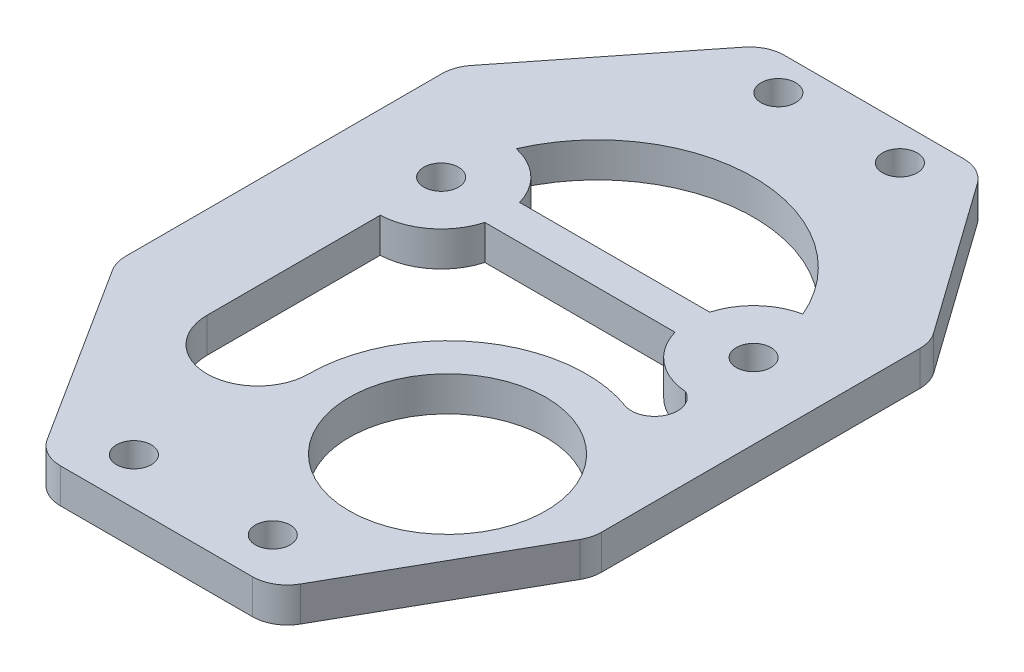
from build123d import *

# Parameters (mm, degrees)
SKETCH1_R          = 8.5
SKETCH1_R_2        = 1.5
BASE_FLANGE1_DEPTH = 3
SCALE1_SCALE       = 1.8


# Sheet-metal steps are written as plain solids
with BuildPart() as part:
    # Sketch1 → Base-Flange1 (new body)
    with BuildSketch(Plane(origin=(0, 0, 0), x_dir=(1, 0, 0), z_dir=(0, 1, 0))):
        with BuildLine():
            Line((19.609421573, -14.059417906), (10.862109445, -29.480175346))
            ThreePointArc((10.862109445, -29.480175346), (9.762567662, -30.59234701), (8.252687872, -31))
            Line((8.252687872, -31), (-8.352599575, -31))
            ThreePointArc((-8.352599575, -31), (-9.796606082, -30.629609326), (-10.884048227, -29.609896806))
            Line((-10.884048227, -29.609896806), (-20.742852548, -14.107625594))
            ThreePointArc((-20.742852548, -14.107625594), (-21.091885276, -13.336076582), (-21.211403896, -12.497728788))
            Line((-21.211403896, -12.497728788), (-21.211403896, 14.839305313))
            ThreePointArc((-21.211403896, 14.839305313), (-21.044943633, 15.824725306), (-20.564035521, 16.700789784))
            Line((-20.564035521, 16.700789784), (-10.150833328, 29.861484472))
            ThreePointArc((-10.150833328, 29.861484472), (-9.105019706, 30.700412322), (-7.798201703, 31))
            Line((-7.798201703, 31), (7.702138241, 31))
            ThreePointArc((7.702138241, 31), (9.077698333, 30.666052219), (10.147014932, 29.738556288))
            Line((10.147014932, 29.738556288), (19.444876691, 16.663267527))
            ThreePointArc((19.444876691, 16.663267527), (19.857851472, 15.837226972), (20, 14.924711239))
            Line((20, 14.924711239), (20, -12.57924256))
            ThreePointArc((20, -12.57924256), (19.900712388, -13.344662472), (19.609421573, -14.059417906))
        make_face()
        with Locations(Location((7.5, -13.4, 0), (0, 0, 270))):
            Circle(SKETCH1_R, mode=Mode.SUBTRACT)
        with Locations(Location((6, -27, 0), (0, 0, 270))):
            Circle(SKETCH1_R_2, mode=Mode.SUBTRACT)
        with Locations(Location((-6, -27, 0), (0, 0, 270))):
            Circle(SKETCH1_R_2, mode=Mode.SUBTRACT)
        with Locations(Location((5.25, 27.940782939, 0), (0, 0, 270))):
            Circle(SKETCH1_R_2, mode=Mode.SUBTRACT)
        with Locations(Location((-5.25, 27.940782939, 0), (0, 0, 270))):
            Circle(SKETCH1_R_2, mode=Mode.SUBTRACT)
        with Locations(Location((13.5, 7.05, 0), (0, 0, 270))):
            Circle(SKETCH1_R_2, mode=Mode.SUBTRACT)
        with Locations(Location((-13.5, 7.05, 0), (0, 0, 270))):
            Circle(SKETCH1_R_2, mode=Mode.SUBTRACT)
        with BuildLine():
            Line((-13.281403896, 0), (-13.281403896, 1.567980996))
            ThreePointArc((-13.281403896, 1.567980996), (-10.106558233, 2.738982767), (-8.222660082, 5.55))
            Line((-8.222660082, 5.55), (8.208497378, 5.55))
            ThreePointArc((8.208497378, 5.55), (10.031018679, 2.781959631), (13.113110627, 1.563624456))
            ThreePointArc((13.113110627, 1.563624456), (14.07117407, -0.953003234), (11.655254401, -2.142386538))
            ThreePointArc((11.655254401, -2.142386538), (0.639353267, -3.554619032), (-4.5, -13.4))
            ThreePointArc((-4.5, -13.4), (-8.890701948, -17.790701948), (-13.281403896, -13.4))
            Line((-13.281403896, -13.4), (-13.281403896, 0))
        make_face(mode=Mode.SUBTRACT)
        with BuildLine():
            Line((-8.222660082, 8.55), (8.208497378, 8.55))
            ThreePointArc((8.208497378, 8.55), (9.751572067, 11.074833914), (12.37962963, 12.434679214))
            ThreePointArc((12.37962963, 12.434679214), (-0.006957749, 20.549998207), (-12.385173459, 12.42191571))
            ThreePointArc((-12.385173459, 12.42191571), (-9.763306163, 11.067142739), (-8.222660082, 8.55))
        make_face(mode=Mode.SUBTRACT)
    extrude(amount=BASE_FLANGE1_DEPTH)


with BuildPart() as part_1:
    # Scale1: scaled about (-1.130925292, 1.5, -0.876080417)
    add(part.part.scale(SCALE1_SCALE).moved(Location((0.904740234, -1.2, 0.700864334))))


solid = part_1.part
